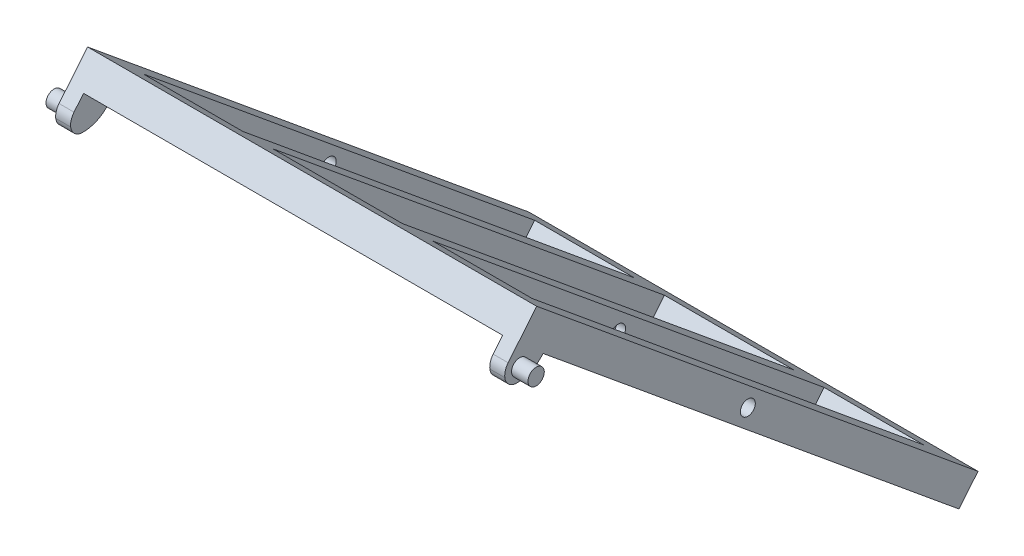
from build123d import *

# Parameters (mm, degrees)
CROQUIS1_W              = 1500
CROQUIS1_H              = 1910
CROQUIS1_W_2            = 1300
CROQUIS1_H_2            = 1695.501409597
SALIENTE_EXTRUIR1_DEPTH = 100
CROQUIS2_W              = 50
CROQUIS2_H              = 100
SALIENTE_EXTRUIR2_DEPTH = 110
CROQUIS3_R              = 27.184499999
SALIENTE_EXTRUIR3_DEPTH = 55
REDONDEO1_R             = 50
REDONDEO2_R             = 110
REDONDEO3_R             = 40
SIMETR_A6_START         = -205.332665454
SIMETR_A6_DEPTH         = 50
SIMETR_A6_2_OUTLINE_R   = 27.184499999
SIMETR_A6_2_DEPTH       = 105
CROQUIS4_W              = 100
CROQUIS4_H              = 1695.501409597
SALIENTE_EXTRUIR4_DEPTH = 100
CROQUIS5_R              = 25
CORTAR_EXTRUIR1_DEPTH   = 30
CROQUIS6_R              = 25
CORTAR_EXTRUIR3_DEPTH   = 4447.028443617


with BuildPart() as part:
    # Croquis1 → Saliente-Extruir1 (new body)
    with BuildSketch(Plane(origin=(0, -1955.253607577, 1610.989797583), x_dir=(1, 0, 0), z_dir=(0, 0.771778946447621, -0.6358909166045701))):
        with Locations((-905.332665454, -2110.391476147)):
            Rectangle(CROQUIS1_W, CROQUIS1_H)
        with Locations((-905.332665454, -2107.640771349)):
            Rectangle(CROQUIS1_W_2, CROQUIS1_H_2, mode=Mode.SUBTRACT)
    extrude(amount=SALIENTE_EXTRUIR1_DEPTH)

    # Croquis2 → Saliente-Extruir2 (add)
    with BuildSketch(Plane(origin=(0, 1949.254595519, 2365.804603911), x_dir=(1, 0, 0), z_dir=(-5.363902149474557e-15, 0.6358909166045701, 0.771778946447621))):
        with Locations((-1630.332665455, -2583.437348319)):
            Rectangle(CROQUIS2_W, CROQUIS2_H)
    extrude(amount=-SALIENTE_EXTRUIR2_DEPTH)

    # Croquis3 → Saliente-Extruir3 (add)
    with BuildSketch(Plane.ZY.offset(1655.332665454)):
        with Locations(Location((3970.000000001, -76.38250521, 0), (0, 0, 180))):
            Circle(CROQUIS3_R)
    extrude(amount=SALIENTE_EXTRUIR3_DEPTH)

    # Redondeo1
    redondeo1_edges = [part.edges().sort_by_distance(p)[0] for p in [
        (-1630.332665454, -83.176906702, 4040.383493154),
    ]]
    fillet(redondeo1_edges, radius=REDONDEO1_R)

    # Redondeo2
    # the kernel refuses this fillet: 110 mm, written as the material it takes off along each edge
    with BuildSketch(Plane(origin=(-1360.383691176, -153.124907529, 3955.487809045), x_dir=(-5.363902149475724e-15, 0.6358909166045759, 0.7717789464476161), z_dir=(-1, 0, 0))) as redondeo2_piece_1:
        with BuildLine():
            CenterArc((110, 97.979589711), REDONDEO2_R, 180, 62.964308211)
            Line((0, 97.979589711), (0, 0))
            Line((0, 0), (60, 0))
        make_face()
    extrude(amount=539.897948557, mode=Mode.SUBTRACT)

    # Redondeo3
    redondeo3_edges = [part.edges().sort_by_distance(p)[0] for p in [
        (-1630.332665454, -114.971452533, 4001.794545831),
    ]]
    fillet(redondeo3_edges, radius=REDONDEO3_R)

    # Simetría6: read off the stored shape, not the designer's step
    # Simetría6 outline → Simetría6 (add)
    with BuildSketch(Plane.YZ.offset(SIMETR_A6_START)):
        with BuildLine():
            ThreePointArc((-117.519718806, 3980.993137388), (-107.655684266, 3932.466465304), (-77.506323008, 3893.183477935))
            Line((-77.506323008, 3893.183477935), (-75.947012884, 3891.898717384))
            Line((-75.947012884, 3891.898717384), (-5.999012058, 3976.794401493))
            Line((-5.999012058, 3976.794401493), (-44.58795938, 4008.588947324))
            ThreePointArc((-44.58795938, 4008.588947324), (-62.233936584, 4017.956417776), (-82.138761146, 4019.667549947))
            ThreePointArc((-82.138761146, 4019.667549947), (-107.046738875, 4006.933211198), (-117.519718806, 3980.993137388))
        make_face()
    extrude(amount=SIMETR_A6_DEPTH)

    # Simetr_a6 2 outline → Simetr_a6 2 (add)
    with BuildSketch(Plane.YZ.offset(SIMETR_A6_START)):
        with Locations((-76.38250521, 3970.000000001)):
            Circle(SIMETR_A6_2_OUTLINE_R)
    extrude(amount=SIMETR_A6_2_DEPTH)

    # Croquis4 → Saliente-Extruir4 (add)
    with BuildSketch(Plane(origin=(0, -1878.075712932, 1547.400705922), x_dir=(1, 0, 0), z_dir=(0, 0.771778946447621, -0.63589091660457))):
        with Locations((-1172.032665454, -2107.640771349)):
            Rectangle(CROQUIS4_W, CROQUIS4_H)
        with Locations((-638.632665454, -2107.640771349)):
            Rectangle(CROQUIS4_W, CROQUIS4_H)
    extrude(amount=-SALIENTE_EXTRUIR4_DEPTH)

    # Croquis5 → Cortar-Extruir1 (cut)
    with BuildSketch(Plane(origin=(-588.632665454, 0, 0), x_dir=(0, 0, -1), z_dir=(1, 0, 0))):
        with Locations((-3207.950961806, -574.685890092)):
            Circle(CROQUIS5_R)
    cortar_extruir1 = extrude(amount=-CORTAR_EXTRUIR1_DEPTH, mode=Mode.SUBTRACT)

    # Croquis6 → Cortar-Extruir3 (cut, through all)
    with BuildSketch(Plane.ZY.offset(255.332665454)):
        with Locations(Location((3207.950961806, -574.685890092, 0), (0, 0, 180))):
            Circle(CROQUIS6_R)
    cortar_extruir3 = extrude(amount=-CORTAR_EXTRUIR3_DEPTH, mode=Mode.SUBTRACT)

    # Simetría11: Cortar-Extruir1, Cortar-Extruir3 across plane
    add(cortar_extruir1.mirror(Plane(origin=(-905.332665454, 0, 0), x_dir=(0, 0, 1), z_dir=(1, 0, 0))), mode=Mode.SUBTRACT)
    add(cortar_extruir3.mirror(Plane(origin=(-905.332665454, 0, 0), x_dir=(0, 0, 1), z_dir=(1, 0, 0))), mode=Mode.SUBTRACT)


solid = part.part
